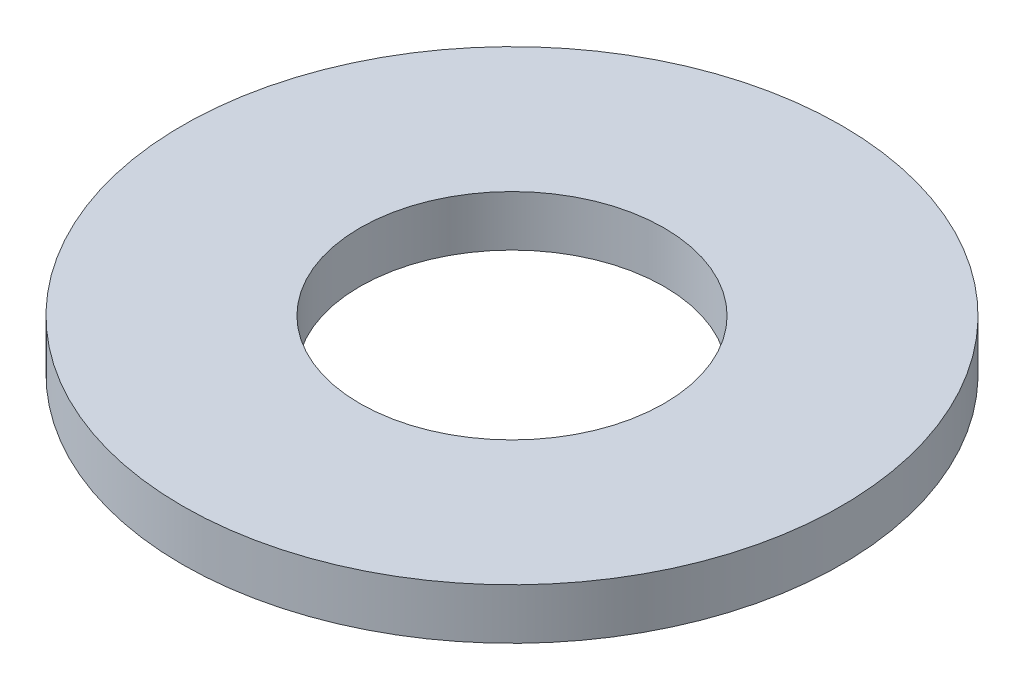
from build123d import *

# Parameters (mm, degrees)
SKETCH1_R           = 97.5
BOSS_EXTRUDE1_DEPTH = 15
SKETCH2_R           = 45
CUT_EXTRUDE1_DEPTH  = 139.699315067


with BuildPart() as part:
    # Sketch1 → Boss-Extrude1 (new body)
    with BuildSketch(Plane(origin=(0, 0, 0), x_dir=(1, 0, 0), z_dir=(0, 1, 0))):
        Circle(SKETCH1_R)
    extrude(amount=BOSS_EXTRUDE1_DEPTH)

    # Sketch2 → Cut-Extrude1 (cut, through all)
    with BuildSketch(Plane(origin=(0, 0, 0), x_dir=(1, 0, 0), z_dir=(0, 1, 0))):
        Circle(SKETCH2_R)
    extrude(amount=CUT_EXTRUDE1_DEPTH, mode=Mode.SUBTRACT)


solid = part.part
